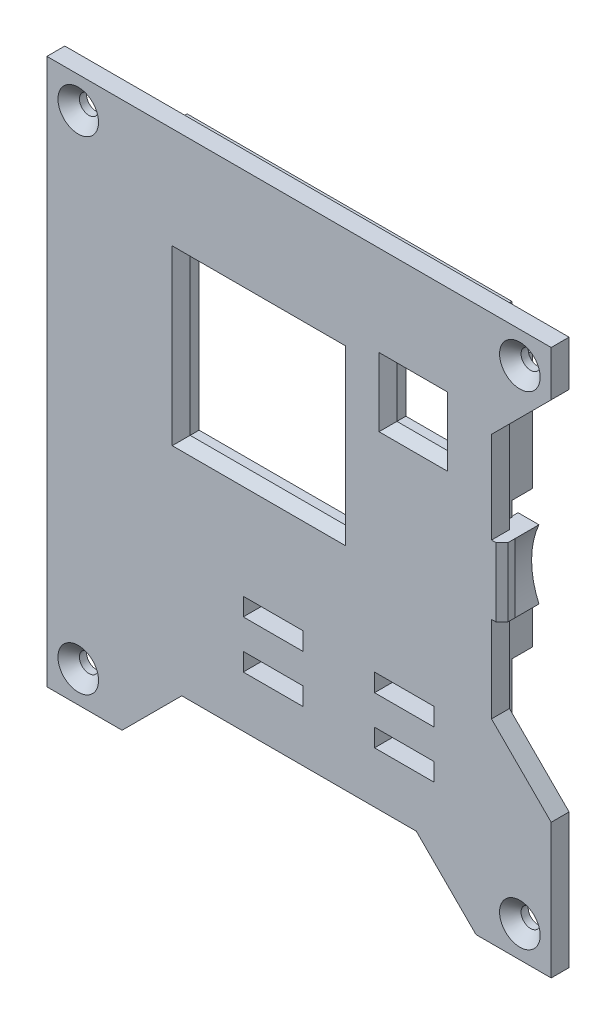
from build123d import *

# Parameters (mm, degrees)
BOSS_EXTRUDE1_DEPTH     = 3
SKETCH3_R               = 1.6
CUT_EXTRUDE1_DEPTH      = 3
CHAMFER1_SIZE           = 1.8
SKETCH5_W               = 26
SKETCH5_H               = 26
SKETCH5_W_2             = 8.5
SKETCH5_H_2             = 8.5
CUT_EXTRUDE2_DEPTH      = 3
CHAMFER2_SIZE           = 1.5
SKETCH7_W               = 3.5
SKETCH7_H               = 11.5
BOSS_EXTRUDE3_DEPTH     = 6.2
CUT_EXTRUDE3_DEPTH      = 125.687357779
CUT_EXTRUDE3_DEPTH_BACK = 3
CHAMFER3_SIZE           = 1
SKETCH9_W               = 25
SKETCH9_H               = 4
SKETCH9_W_2             = 4
SKETCH9_H_2             = 5
BOSS_EXTRUDE4_DEPTH     = 1.9
BOSS_EXTRUDE5_DEPTH     = 5.5
SKETCH11_W              = 4
SKETCH11_H              = 17.5
BOSS_EXTRUDE6_DEPTH     = 3.5
BOSS_EXTRUDE7_DEPTH     = 4.5
SKETCH13_W              = 3.4
SKETCH13_H              = 16.58647312
BOSS_EXTRUDE8_DEPTH     = 2
SKETCH14_W              = 10
SKETCH14_H              = 3
CUT_EXTRUDE4_DEPTH      = 3
CHAMFER4_SIZE           = 1


with BuildPart() as part:
    # Sketch1 → Boss-Extrude1 (new body)
    with BuildSketch(Plane.XY):
        Polygon((0.01715505, 91.462274694), (84.51715505, 91.462274694), (84.51715505, 83.862274694), (74.51715505, 73.862274694), (74.51715505, 32.562274694), (84.51715505, 22.562274694), (84.51715505, -0.037725306), (71.91715505, -0.037725306), (61.91715505, 9.962274694), (22.61715505, 9.962274694), (12.61715505, -0.037725306), (0.01715505, -0.037725306), align=None)
    extrude(amount=BOSS_EXTRUDE1_DEPTH)

    # Sketch3 → Cut-Extrude1 (cut)
    with BuildSketch(Plane.XY.offset(3)):
        with Locations((5.26715505, 86.212274694)):
            Circle(SKETCH3_R)
        with Locations((79.26715505, 86.212274694)):
            Circle(SKETCH3_R)
        with Locations((5.26715505, 5.212274694)):
            Circle(SKETCH3_R)
        with Locations((79.26715505, 5.212274694)):
            Circle(SKETCH3_R)
    extrude(amount=-CUT_EXTRUDE1_DEPTH, mode=Mode.SUBTRACT)

    # Chamfer1
    chamfer1_edges = [part.edges().sort_by_distance(p)[0] for p in [
        (77.66715505, 86.212274694, 3),
        (3.66715505, 5.212274694, 3),
        (77.66715505, 5.212274694, 3),
        (3.66715505, 86.212274694, 3),
    ]]
    chamfer(chamfer1_edges, length=CHAMFER1_SIZE)

    # Sketch5 → Cut-Extrude2 (cut)
    with BuildSketch(Plane.XY.offset(3)):
        with Locations((35.51715505, 59.962274694)):
            Rectangle(SKETCH5_W, SKETCH5_H)
        with Locations((61.41715505, 70.562274694)):
            Rectangle(SKETCH5_W_2, SKETCH5_H_2)
    extrude(amount=-CUT_EXTRUDE2_DEPTH, mode=Mode.SUBTRACT)

    # Chamfer2
    chamfer2_edges = [part.edges().sort_by_distance(p)[0] for p in [
        (57.16715505, 70.562274694, 3),
        (61.41715505, 66.312274694, 3),
        (65.66715505, 70.562274694, 3),
        (61.41715505, 74.812274694, 3),
        (22.51715505, 59.962274694, 3),
        (35.51715505, 46.962274694, 3),
        (48.51715505, 59.962274694, 3),
        (35.51715505, 72.962274694, 3),
    ]]
    chamfer(chamfer2_edges, length=CHAMFER2_SIZE)

    # Sketch7 → Boss-Extrude3 (add)
    with BuildSketch(Plane.XY.offset(3)):
        with Locations((74.51715505, 52.762274694)):
            Rectangle(SKETCH7_W, SKETCH7_H)
    extrude(amount=-BOSS_EXTRUDE3_DEPTH)

    # Sketch8 → Cut-Extrude3 (cut, two sides: drawn at the far end of the back side and taken through both)
    with BuildSketch(Plane(origin=(0, 0, -3.2), x_dir=(-1, 0, 0), z_dir=(0, 0, -1)).offset(-CUT_EXTRUDE3_DEPTH_BACK)):
        with BuildLine():
            Line((-76.26715505, 58.512274694), (-76.26715505, 47.012274694))
            ThreePointArc((-76.26715505, 47.012274694), (-75.034557132, 52.762274694), (-76.26715505, 58.512274694))
        make_face()
    extrude(amount=CUT_EXTRUDE3_DEPTH + CUT_EXTRUDE3_DEPTH_BACK, mode=Mode.SUBTRACT)

    # Chamfer3
    # the kernel refuses this chamfer: 1 mm, written as the material it takes off along each edge
    with BuildSketch(Plane(origin=(76.26715505, 61.083957682, -0.2), x_dir=(0.02749587661058217, 0, 0.9996219169112968), z_dir=(0, -1, 0))) as chamfer3_piece_1_section:
        Polygon((CHAMFER3_SIZE * 0.999621916911, CHAMFER3_SIZE * 0.0274958766106), (-CHAMFER3_SIZE * 0.0274958766106, CHAMFER3_SIZE * 0.999621916911), (0, 0), align=None)
    chamfer3_piece_1 = extrude(amount=16.643365976, mode=Mode.PRIVATE)
    chamfer3_piece_1 = chamfer3_piece_1 & Plane(origin=(89.06256948, 52.762274694, 0.149616296), x_dir=(-0.9121331028647569, -0.4098941359159838, 0), z_dir=(0, 0, 1)) * Cylinder(14.028012348, 38, mode=Mode.PRIVATE)
    add(chamfer3_piece_1, mode=Mode.SUBTRACT)

    # Sketch9 → Boss-Extrude4 (add)
    with BuildSketch(Plane(origin=(0, 0, 0), x_dir=(-1, 0, 0), z_dir=(0, 0, -1))):
        with Locations((-35.51715505, 37.962274694)):
            Rectangle(SKETCH9_W, SKETCH9_H)
        with Locations((-48.51715505, 77.462274694)):
            Rectangle(SKETCH9_W_2, SKETCH9_H_2)
        with Locations((-22.51715505, 77.462274694)):
            Rectangle(SKETCH9_W_2, SKETCH9_H_2)
    extrude(amount=BOSS_EXTRUDE4_DEPTH)

    # Sketch10 → Boss-Extrude5 (add)
    with BuildSketch(Plane(origin=(0, 0, 0), x_dir=(-1, 0, 0), z_dir=(0, 0, -1))):
        Polygon((-21.41715505, 80.962274694), (-72.91715505, 80.962274694), (-72.91715505, 60.962274694), (-69.51715505, 60.962274694), (-69.51715505, 77.962274694), (-21.41715505, 77.962274694), align=None)
        Polygon((-72.91715505, 44.424333564), (-69.51715505, 44.424333564), (-69.51715505, 40.962274694), (-52.91715505, 40.962274694), (-52.91715505, 37.962274694), (-72.91715505, 37.962274694), align=None)
    extrude(amount=BOSS_EXTRUDE5_DEPTH)

    # Sketch11 → Boss-Extrude6 (add)
    with BuildSketch(Plane(origin=(0, 0, 0), x_dir=(-1, 0, 0), z_dir=(0, 0, -1))):
        with Locations((-26.01715505, 27.712274694)):
            Rectangle(SKETCH11_W, SKETCH11_H)
    extrude(amount=BOSS_EXTRUDE6_DEPTH)

    # Sketch12 → Boss-Extrude7 (add)
    with BuildSketch(Plane(origin=(0, 0, 0), x_dir=(-1, 0, 0), z_dir=(0, 0, -1))):
        Polygon((-19.71715505, 79.962274694), (-1.71715505, 79.962274694), (-1.71715505, 72.462274694), (-1.71715505, 19.462274694), (-1.71715505, 11.462274694), (-19.71715505, 11.462274694), (-19.71715505, 19.462274694), (-3.71715505, 19.462274694), (-3.71715505, 71.962274694), (-19.71715505, 71.962274694), align=None)
    extrude(amount=BOSS_EXTRUDE7_DEPTH)

    # Sketch13 → Boss-Extrude8 (add)
    with BuildSketch(Plane(origin=(0, 0, 0), x_dir=(-1, 0, 0), z_dir=(0, 0, -1))):
        Polygon((-18.51715505, 77.962274694), (-21.91715505, 77.962274694), (-21.91715505, 86.862274694), (-69.91715505, 86.862274694), (-69.91715505, 80.962274694), (-72.91715505, 80.962274694), (-72.91715505, 89.862274694), (-18.51715505, 89.862274694), align=None)
        Polygon((-72.91715505, 37.962274694), (-69.91715505, 37.962274694), (-69.91715505, 14.562274694), (-1.61715505, 14.562274694), (-1.61715505, 11.562274694), (-72.91715505, 11.562274694), align=None)
        with Locations((-71.21715505, 52.669038134)):
            Rectangle(SKETCH13_W, SKETCH13_H)
    extrude(amount=BOSS_EXTRUDE8_DEPTH)

    # Sketch14 → Cut-Extrude4 (cut)
    with BuildSketch(Plane(origin=(0, 0, 0), x_dir=(-1, 0, 0), z_dir=(0, 0, -1))):
        with Locations((-37.91715505, 20.062274694)):
            Rectangle(SKETCH14_W, SKETCH14_H)
        with Locations((-59.91715505, 20.062274694)):
            Rectangle(SKETCH14_W, SKETCH14_H)
        with Locations((-37.91715505, 28.062274694)):
            Rectangle(SKETCH14_W, SKETCH14_H)
        with Locations((-59.91715505, 28.062274694)):
            Rectangle(SKETCH14_W, SKETCH14_H)
    extrude(amount=-CUT_EXTRUDE4_DEPTH, mode=Mode.SUBTRACT)

    # Chamfer4
    chamfer4_edges = [part.edges().sort_by_distance(p)[0] for p in [
        (76.26715505, 52.762274694, 3),
    ]]
    chamfer(chamfer4_edges, length=CHAMFER4_SIZE)


solid = part.part
